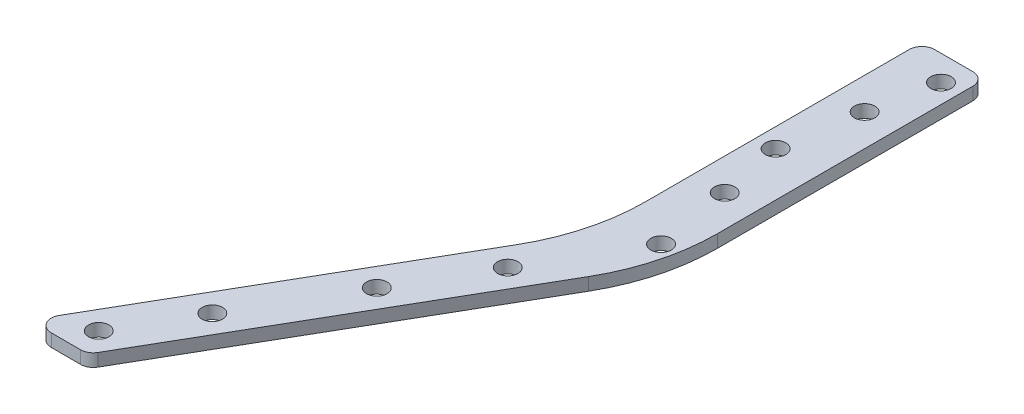
from build123d import *

# Parameters (mm, degrees)
BASE_FLANGE1_DEPTH     = 3.175
SKETCH6_R              = 2.5527
CUT_EXTRUDE1_DEPTH     = 179.996051516
FILLET1_R              = 3.175
FILLET2_R              = 50.8
F_10_CLEARANCE_HOLE1_D = 5.1054


# Sheet-metal steps are written as plain solids
with BuildPart() as part:
    # Sketch1 → Base-Flange1 (new body)
    with BuildSketch(Plane(origin=(0, 0, 0), x_dir=(1, 0, 0), z_dir=(0, 1, 0))):
        Polygon((0, -82.55), (-51.326438931, -171.45), (-36.661742094, -171.45), (15.875, -80.45369343), (15.875, 0), (0, 0), align=None)
    extrude(amount=-BASE_FLANGE1_DEPTH)

    # Sketch6 → Cut-Extrude1 (cut, through all)
    with BuildSketch(Plane(origin=(0, 0, 0), x_dir=(1, 0, 0), z_dir=(0, 1, 0))):
        with Locations(Location((-40.327916303, -165.1, 0), (0, 0, 270))):
            Circle(SKETCH6_R)
        with Locations(Location((-14.927916303, -121.105909488, 0), (0, 0, 270))):
            Circle(SKETCH6_R)
        with Locations(Location((11.1125, -6.35, 0), (0, 0, 270))):
            Circle(SKETCH6_R)
        with Locations(Location((4.7625, -41.275, 0), (0, 0, 270))):
            Circle(SKETCH6_R)
        with Locations(Location((11.1125, -76.2, 0), (0, 0, 270))):
            Circle(SKETCH6_R)
    extrude(amount=-CUT_EXTRUDE1_DEPTH, mode=Mode.SUBTRACT)

    # Fillet1
    fillet1_edges = [part.edges().sort_by_distance(p)[0] for p in [
        (-36.661742094, -1.5875, 171.45),
        (-51.326438931, -1.5875, 171.45),
        (0, -1.5875, 0),
        (15.875, -1.5875, 0),
    ]]
    fillet(fillet1_edges, radius=FILLET1_R)

    # Fillet2
    fillet2_edges = [part.edges().sort_by_distance(p)[0] for p in [
        (0, -1.5875, 82.55),
        (15.875, -1.5875, 80.45369343),
    ]]
    fillet(fillet2_edges, radius=FILLET2_R)

    # #10 Clearance Hole1 (through all)
    with Locations(Plane(origin=(0, 0, 0), x_dir=(1, 0, 0), z_dir=(0, 1, 0))):
        with Locations((7.9375, -22.225), (7.9375, -57.15), (-2.964677617, -100.384972261), (-29.952177617, -147.12869343)):
            Hole(F_10_CLEARANCE_HOLE1_D / 2)


solid = part.part
